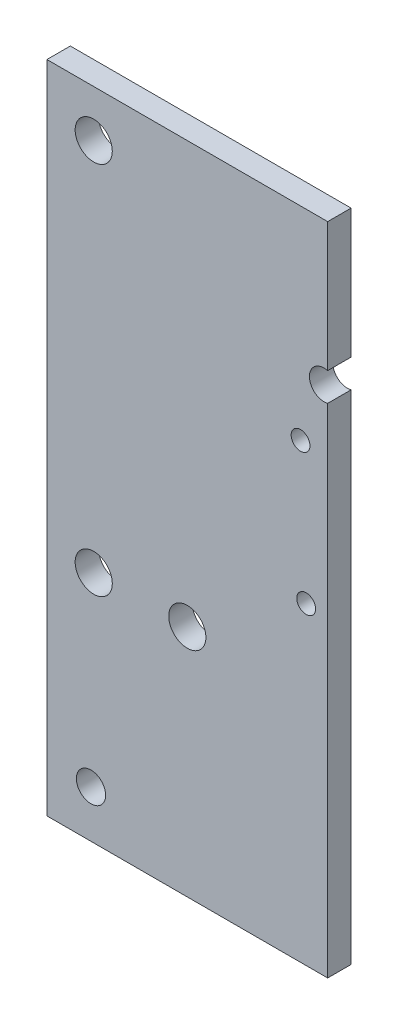
from build123d import *

# Parameters (mm, degrees)
SKETCH2_W                       = 177.8
SKETCH2_H                       = 76.2
BOSS_EXTRUDE1_DEPTH             = 6.35
F_3_8_CLEARANCE_HOLE1_D         = 10.0838
TAP_DRILL_FOR_1_4_20_TAP1_D     = 5.1054
TAP_DRILL_FOR_3_8_16_TAP2_D     = 7.9375
TAP_DRILL_FOR_3_8_16_TAP2_DEPTH = 12.7
TAP_DRILL_FOR_3_8_16_TAP2_TIP   = 2.384665582


with BuildPart() as part:
    # Sketch2 → Boss-Extrude1 (new body)
    with BuildSketch(Plane(origin=(0, 0, 0), x_dir=(0, 1, 0), z_dir=(0, 0, 1))):
        with Locations((88.9, 38.1)):
            Rectangle(SKETCH2_W, SKETCH2_H)
    extrude(amount=BOSS_EXTRUDE1_DEPTH)

    # 3/8 Clearance Hole1 (through all)
    with Locations(Plane.XY.offset(6.35)):
        with Locations((-38.1, 63.5), (-63.5, 63.5), (-63.5, 165.1)):
            Hole(F_3_8_CLEARANCE_HOLE1_D / 2)

    # Tap Drill for 1/4-20 Tap1 (through all)
    with Locations(Plane.XY.offset(6.35)):
        with Locations((-5.827835183, 85.09), (-7.366, 122.682)):
            Hole(TAP_DRILL_FOR_1_4_20_TAP1_D / 2)

    # Tap Drill for 3/8-16 Tap2
    with Locations(Plane.XY.offset(6.35)):
        with Locations((-64.239584559, 12.800277848), (-0.985015435, 138.920704561)):
            Hole(TAP_DRILL_FOR_3_8_16_TAP2_D / 2, depth=TAP_DRILL_FOR_3_8_16_TAP2_DEPTH)
            with Locations((0, 0, -(TAP_DRILL_FOR_3_8_16_TAP2_DEPTH + TAP_DRILL_FOR_3_8_16_TAP2_TIP / 2))):  # 118° drill point
                Cone(0, TAP_DRILL_FOR_3_8_16_TAP2_D / 2, TAP_DRILL_FOR_3_8_16_TAP2_TIP, mode=Mode.SUBTRACT)


solid = part.part
